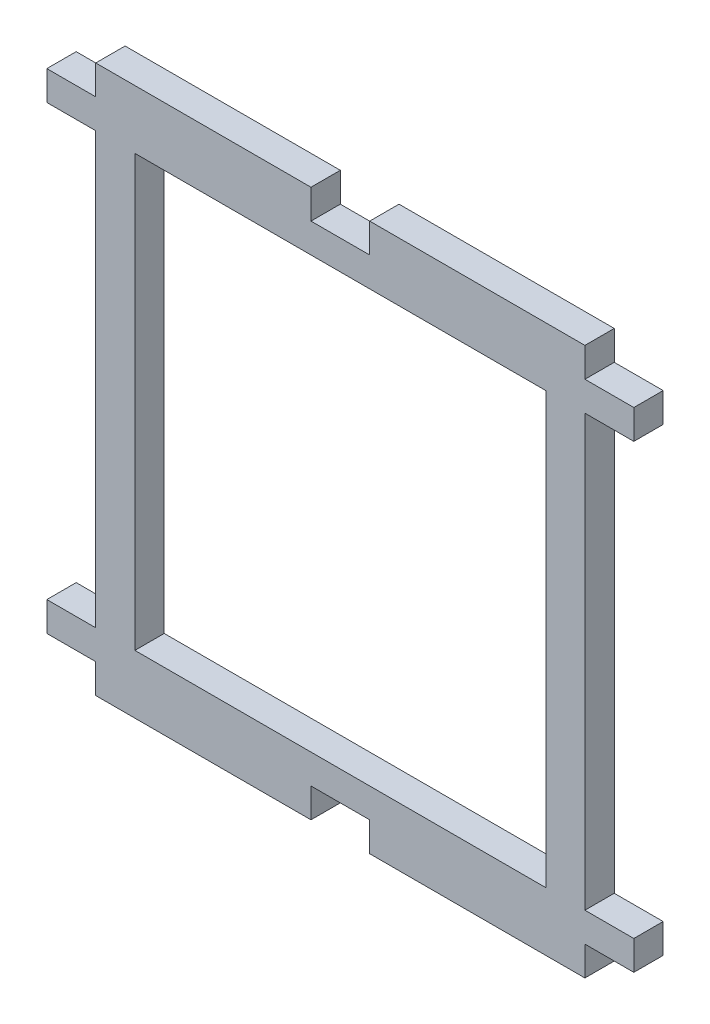
from build123d import *

# Parameters (mm, degrees)
SKETCH1_W           = 42
SKETCH1_H           = 44
BOSS_EXTRUDE1_DEPTH = 3


with BuildPart() as part:
    # Sketch1 → Boss-Extrude1 (new body)
    with BuildSketch(Plane.XY):
        Polygon((-41.282447519, 35.995778619), (-36.282447519, 35.995778619), (-36.282447519, -8.004221381), (-41.282447519, -8.004221381), (-41.282447519, -11.004221381), (-36.282447519, -11.004221381), (-36.282447519, -14.004221381), (-14.282447519, -14.004221381), (-14.282447519, -11.004221381), (-8.282447519, -11.004221381), (-8.282447519, -14.004221381), (13.717552481, -14.004221381), (13.717552481, -11.004221381), (18.717552481, -11.004221381), (18.717552481, -8.004221381), (13.717552481, -8.004221381), (13.717552481, 35.995778619), (18.717552481, 35.995778619), (18.717552481, 38.995778619), (13.717552481, 38.995778619), (13.717552481, 41.995778619), (-8.282447519, 41.995778619), (-8.282447519, 38.995778619), (-14.282447519, 38.995778619), (-14.282447519, 41.995778619), (-36.282447519, 41.995778619), (-36.282447519, 38.995778619), (-41.282447519, 38.995778619), align=None)
        with Locations((-11.282447519, 13.995778619)):
            Rectangle(SKETCH1_W, SKETCH1_H, mode=Mode.SUBTRACT)
    extrude(amount=BOSS_EXTRUDE1_DEPTH)


solid = part.part
